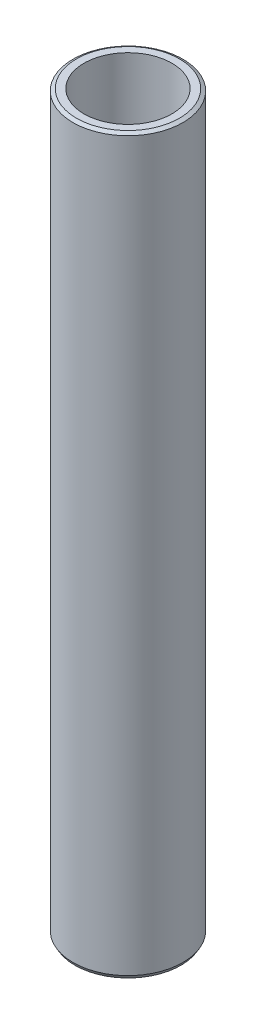
from build123d import *
from OCP.BRepFilletAPI import BRepFilletAPI_MakeChamfer

# Parameters (mm, degrees)
SKETCH1_R           = 45
BOSS_EXTRUDE1_DEPTH = 600
SKETCH2_R           = 35.989088654
CUT_EXTRUDE1_DEPTH  = 604.365560834
CHAMFER1_SIZE       = 1.653510792
CHAMFER1_SIZE2      = 2.863964703


with BuildPart() as part:
    # Sketch1 → Boss-Extrude1 (new body)
    with BuildSketch(Plane(origin=(0, 0, 0), x_dir=(1, 0, 0), z_dir=(0, 1, 0))):
        Circle(SKETCH1_R)
    extrude(amount=BOSS_EXTRUDE1_DEPTH)

    # Sketch2 → Cut-Extrude1 (cut, through all)
    with BuildSketch(Plane(origin=(0, 0, 0), x_dir=(1, 0, 0), z_dir=(0, 1, 0))):
        Circle(SKETCH2_R)
    extrude(amount=CUT_EXTRUDE1_DEPTH, mode=Mode.SUBTRACT)

    # Chamfer1: one chamfer whose edges measure the first distance from different faces: ONE call of the kernel's chamfer builder (chamfer() names one face for all edges)
    chamfer1_edges_1 = [part.edges().sort_by_distance(p)[0] for p in [
        (-45, 600, 0),
    ]]
    chamfer1_side_1 = [part.faces().sort_by_distance(p)[0] for p in [
        (-45, 300, 0),
    ]]
    chamfer1_edges_2 = [part.edges().sort_by_distance(p)[0] for p in [
        (-45, 0, 0),
    ]]
    chamfer1_side_2 = [part.faces().sort_by_distance(p)[0] for p in [
        (-43.727207794, 0, 0),
    ]]
    chamfer1 = BRepFilletAPI_MakeChamfer(part.part.solid().wrapped)
    for e in chamfer1_edges_1:
        chamfer1.Add(CHAMFER1_SIZE, CHAMFER1_SIZE2, e.wrapped, chamfer1_side_1[0].wrapped)  # the first distance lies on this face
    for e in chamfer1_edges_2:
        chamfer1.Add(CHAMFER1_SIZE, CHAMFER1_SIZE2, e.wrapped, chamfer1_side_2[0].wrapped)  # the first distance lies on this face
    add(Compound.cast(chamfer1.Shape()), mode=Mode.REPLACE)


solid = part.part
